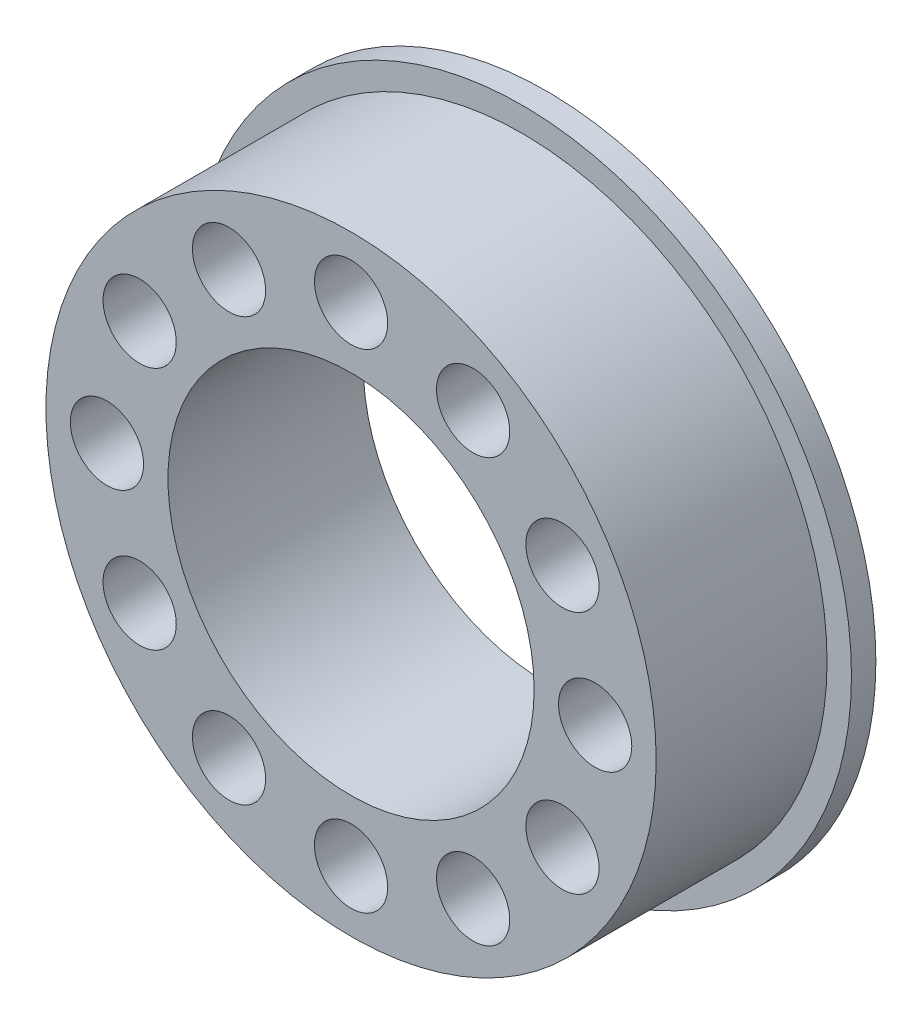
from build123d import *

# Parameters (mm, degrees)
SKETCH_2_R          = 1.5
CUT_EXTRUDE_1_DEPTH = 21.700241544


with BuildPart() as part:
    # ｽｹｯﾁ1 → 回転1 (revolve)
    with BuildSketch(Plane(origin=(0, 0, 0), x_dir=(0, 0, -1), z_dir=(1, 0, 0))):
        Polygon((0, 7.5), (8, 7.5), (8, 13.5), (7, 13.5), (7, 12.5), (0, 12.5), align=None)
    revolve(axis=Axis((0, 0, 0), (0, 0, -1)))

    # ｽｹｯﾁ2 → ｶｯﾄ - 押し出し1 (cut, through all)
    with BuildSketch(Plane.XY):
        with Locations((0, 10)):
            Circle(SKETCH_2_R)
        with Locations((5, 8.660254038)):
            Circle(SKETCH_2_R)
        with Locations((8.660254038, 5)):
            Circle(SKETCH_2_R)
        with Locations((10, 0)):
            Circle(SKETCH_2_R)
        with Locations((8.660254038, -5)):
            Circle(SKETCH_2_R)
        with Locations((5, -8.660254038)):
            Circle(SKETCH_2_R)
        with Locations((0, -10)):
            Circle(SKETCH_2_R)
        with Locations((-5, -8.660254038)):
            Circle(SKETCH_2_R)
        with Locations((-8.660254038, -5)):
            Circle(SKETCH_2_R)
        with Locations((-10, 0)):
            Circle(SKETCH_2_R)
        with Locations((-8.660254038, 5)):
            Circle(SKETCH_2_R)
        with Locations((-5, 8.660254038)):
            Circle(SKETCH_2_R)
    extrude(amount=-CUT_EXTRUDE_1_DEPTH, mode=Mode.SUBTRACT)


solid = part.part
